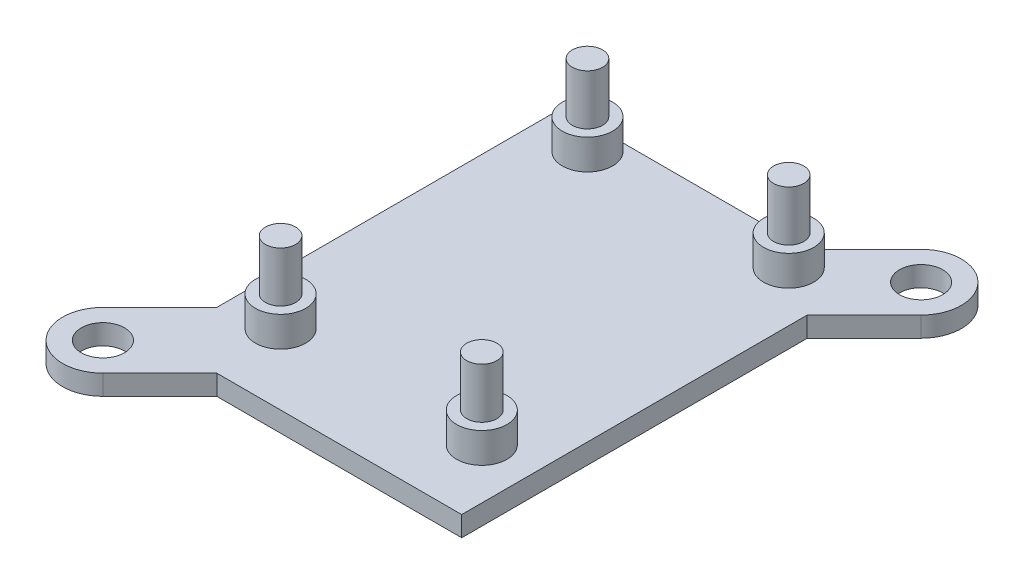
from build123d import *

# Parameters (mm, degrees)
SKETCH1_R           = 2.15
BOSS_EXTRUDE1_DEPTH = 2
SKETCH2_R           = 1.5
BOSS_EXTRUDE2_DEPTH = 10
SKETCH3_R           = 2.5
BOSS_EXTRUDE3_DEPTH = 5


with BuildPart() as part:
    # Sketch1 → Boss-Extrude1 (new body)
    with BuildSketch(Plane(origin=(0, 0, 0), x_dir=(1, 0, 0), z_dir=(0, 1, 0))):
        with BuildLine():
            Line((24.343145751, 0), (0, 0))
            Line((0, 0), (0, -34.343145751))
            Line((0, -34.343145751), (-5.656854249, -40))
            ThreePointArc((-5.656854249, -40), (-5.656854249, -45.656854249), (0, -45.656854249))
            Line((0, -45.656854249), (5.656854249, -40))
            Line((5.656854249, -40), (30, -40))
            Line((30, -40), (30, -5.656854249))
            Line((30, -5.656854249), (35.656854249, 0))
            ThreePointArc((35.656854249, 0), (35.656854249, 5.656854249), (30, 5.656854249))
            Line((30, 5.656854249), (24.343145751, 0))
        make_face()
        with Locations((32.828427125, 2.828427125)):
            Circle(SKETCH1_R, mode=Mode.SUBTRACT)
        with Locations((-2.828427125, -42.828427125)):
            Circle(SKETCH1_R, mode=Mode.SUBTRACT)
    extrude(amount=BOSS_EXTRUDE1_DEPTH)

    # Sketch2 → Boss-Extrude2 (add)
    with BuildSketch(Plane(origin=(0, 0, 0), x_dir=(1, 0, 0), z_dir=(0, 1, 0))):
        with Locations((25, -2.5)):
            Circle(SKETCH2_R)
        with Locations((25, -33)):
            Circle(SKETCH2_R)
        with Locations((5, -33)):
            Circle(SKETCH2_R)
        with Locations((5, -2.5)):
            Circle(SKETCH2_R)
    extrude(amount=BOSS_EXTRUDE2_DEPTH)

    # Sketch3 → Boss-Extrude3 (add)
    with BuildSketch(Plane(origin=(0, 0, 0), x_dir=(1, 0, 0), z_dir=(0, 1, 0))):
        with Locations((5, -2.5)):
            Circle(SKETCH3_R)
        with Locations((25, -2.5)):
            Circle(SKETCH3_R)
        with Locations((25, -33)):
            Circle(SKETCH3_R)
        with Locations((5, -33)):
            Circle(SKETCH3_R)
    extrude(amount=BOSS_EXTRUDE3_DEPTH)


solid = part.part
